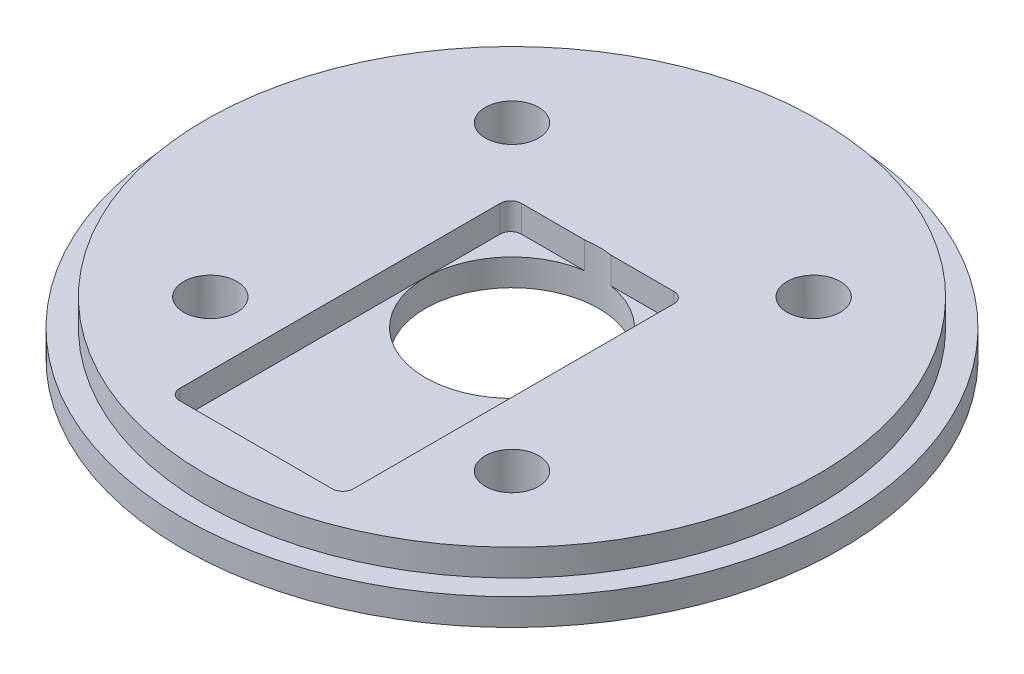
from build123d import *

# Parameters (mm, degrees)
SKETCH2_R                       = 39.243
BOSS_EXTRUDE1_DEPTH             = 6.35
CUT_EXTRUDE1_START              = -3.175
SKETCH4_R                       = 39.243
SKETCH4_R_2                     = 36.5125
CUT_EXTRUDE1_DEPTH              = 3.175
F_1_4_0_25_DIAMETER_HOLE1_D     = 6.35
F_13_16_0_8125_DIAMETER_HOLE1_D = 20.6375
SKETCH9_R                       = 6.35
CUT_EXTRUDE2_DEPTH              = 1.5875
SKETCH11_W                      = 20.7
SKETCH11_H                      = 40.7
CUT_EXTRUDE3_DEPTH              = 3.175
FILLET1_R                       = 1.27


with BuildPart() as part:
    # Sketch2 → Boss-Extrude1 (new body)
    with BuildSketch(Plane(origin=(0, 0, 0), x_dir=(1, 0, 0), z_dir=(0, 1, 0))):
        Circle(SKETCH2_R)
    extrude(amount=BOSS_EXTRUDE1_DEPTH)

    # Sketch4 → Cut-Extrude1 (cut)
    with BuildSketch(Plane(origin=(0, 6.35, 0), x_dir=(1, 0, 0), z_dir=(0, 1, 0)).offset(CUT_EXTRUDE1_START)):
        Circle(SKETCH4_R)
        Circle(SKETCH4_R_2, mode=Mode.SUBTRACT)
    extrude(amount=CUT_EXTRUDE1_DEPTH, mode=Mode.SUBTRACT)

    # 1/4 (0.25) Diameter Hole1 (through all)
    with Locations(Plane(origin=(0, 6.35, 0), x_dir=(1, 0, 0), z_dir=(0, 1, 0))):
        with Locations((-17.960512242, 17.960512242), (-17.960512242, -17.960512242), (17.960512242, 17.960512242), (17.960512242, -17.960512242)):
            Hole(F_1_4_0_25_DIAMETER_HOLE1_D / 2)

    # 13/16 (0.8125) Diameter Hole1 (through all)
    with Locations(Plane(origin=(0, 6.35, 0), x_dir=(1, 0, 0), z_dir=(0, 1, 0))):
        with Locations((0, 0)):
            Hole(F_13_16_0_8125_DIAMETER_HOLE1_D / 2)

    # Sketch9 → Cut-Extrude2 (cut)
    with BuildSketch(Plane.XZ):
        with Locations((-17.960512242, 17.960512242)):
            Circle(SKETCH9_R)
        with Locations((17.960512242, 17.960512242)):
            Circle(SKETCH9_R)
        with Locations((17.960512242, -17.960512242)):
            Circle(SKETCH9_R)
        with Locations((-17.960512242, -17.960512242)):
            Circle(SKETCH9_R)
    extrude(amount=-CUT_EXTRUDE2_DEPTH, mode=Mode.SUBTRACT)

    # Sketch11 → Cut-Extrude3 (cut)
    with BuildSketch(Plane(origin=(0, 6.35, 0), x_dir=(1, 0, 0), z_dir=(0, 1, 0))):
        with Locations((0, -10.15)):
            Rectangle(SKETCH11_W, SKETCH11_H)
    extrude(amount=-CUT_EXTRUDE3_DEPTH, mode=Mode.SUBTRACT)

    # Fillet1
    fillet1_edges = [part.edges().sort_by_distance(p)[0] for p in [
        (-10.35, 4.7625, -10.2),
        (-10.35, 4.7625, 30.5),
        (10.35, 4.7625, 30.5),
        (10.35, 4.7625, -10.2),
    ]]
    fillet(fillet1_edges, radius=FILLET1_R)


solid = part.part
